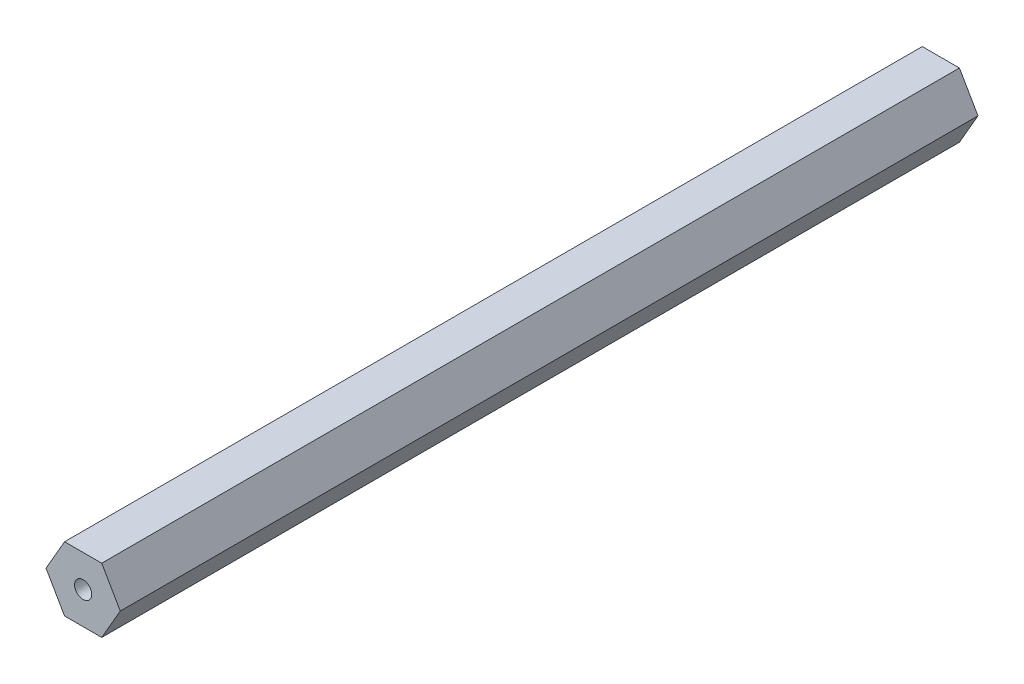
from build123d import *

# Parameters (mm, degrees)
SKETCH1_R           = 1.27
BOSS_EXTRUDE1_DEPTH = 127


with BuildPart() as part:
    # Sketch1 → Boss-Extrude1 (new body)
    with BuildSketch(Plane.XY):
        Polygon((16.408039326, -2.667590064), (13.658408669, 2.094909936), (8.159147355, 2.094909936), (5.409516698, -2.667590064), (8.159147355, -7.430090064), (13.658408669, -7.430090064), align=None)
        with Locations((10.908778012, -2.667590064)):
            Circle(SKETCH1_R, mode=Mode.SUBTRACT)
    extrude(amount=BOSS_EXTRUDE1_DEPTH)


solid = part.part
